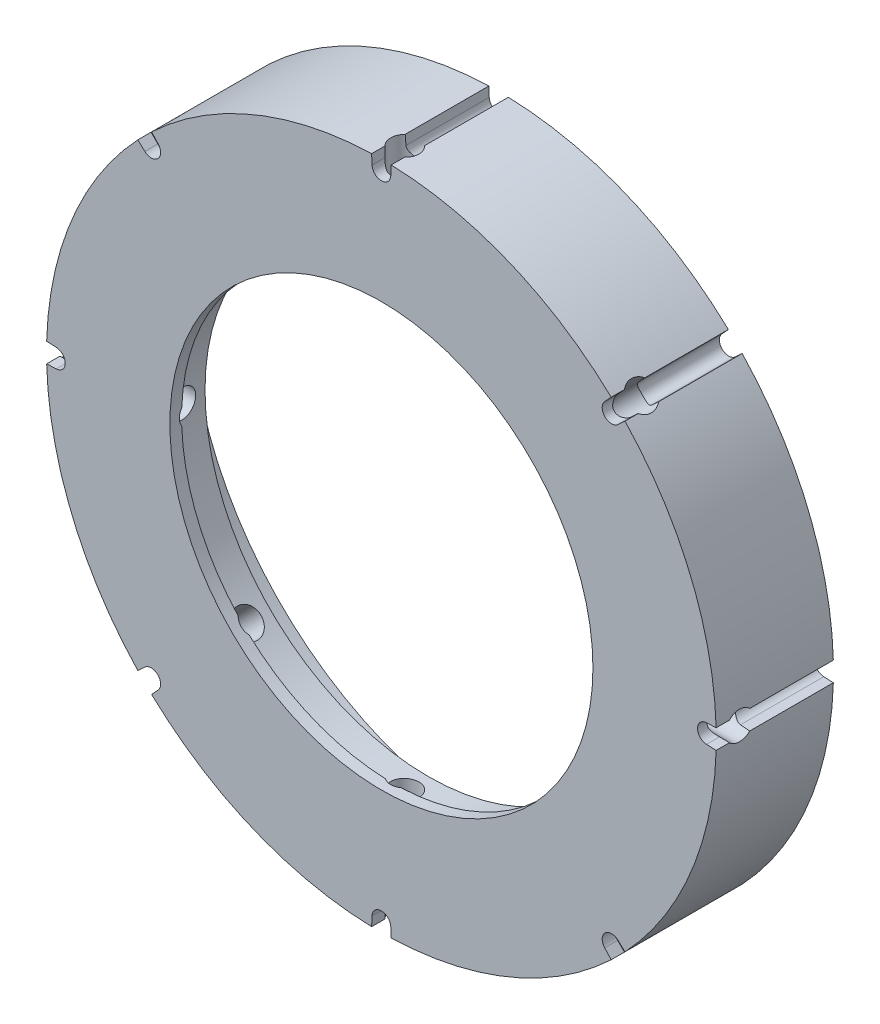
from build123d import *

# Parameters (mm, degrees)
SKETCH1_R           = 14.2875
SKETCH1_R_2         = 13.15
BOSS_EXTRUDE1_DEPTH = 3
BOSS_EXTRUDE2_START = 2
SKETCH2_R           = 14.2875
SKETCH2_R_2         = 9.025
BOSS_EXTRUDE2_DEPTH = 2
SKETCH4_R           = 9.525
CUT_EXTRUDE2_DEPTH  = 1.5
CUT_EXTRUDE4_DEPTH  = 21.815026123
SKETCH6_R           = 0.6
CUT_EXTRUDE5_DEPTH  = 10
CIRPATTERN1_COUNT   = 8


with BuildPart() as part:
    # Sketch1 → Boss-Extrude1 (new body)
    with BuildSketch(Plane.XY):
        Circle(SKETCH1_R)
        Circle(SKETCH1_R_2, mode=Mode.SUBTRACT)
    extrude(amount=-BOSS_EXTRUDE1_DEPTH)

    # Sketch2 → Boss-Extrude2 (add)
    with BuildSketch(Plane.XY.offset(BOSS_EXTRUDE2_START)):
        Circle(SKETCH2_R)
        Circle(SKETCH2_R_2, mode=Mode.SUBTRACT)
    extrude(amount=-BOSS_EXTRUDE2_DEPTH)

    # Sketch4 → Cut-Extrude2 (cut)
    with BuildSketch(Plane(origin=(0, 0, 0), x_dir=(-1, 0, 0), z_dir=(0, 0, -1))):
        Circle(SKETCH4_R)
    extrude(amount=-CUT_EXTRUDE2_DEPTH, mode=Mode.SUBTRACT)

    # Sketch5 → Cut-Extrude4 (cut, through all)
    with BuildSketch(Plane(origin=(0, 0, -3), x_dir=(-1, 0, 0), z_dir=(0, 0, -1))):
        with BuildLine():
            ThreePointArc((-14.281422414, 0.416689427), (-14.2875, 0), (-14.281422414, -0.416689427))
            Line((-14.281422414, -0.416689427), (-13.870916856, -0.399656101))
            ThreePointArc((-13.870916856, -0.399656101), (-13.4875, 0), (-13.870916856, 0.399656101))
            Line((-13.870916856, 0.399656101), (-14.281422414, 0.416689427))
        make_face()
    cut_extrude4 = extrude(amount=-CUT_EXTRUDE4_DEPTH, mode=Mode.SUBTRACT)

    # Sketch6 → Cut-Extrude5 (cut)
    with BuildSketch(Plane(origin=(14.281422414, 0, 0), x_dir=(0, 0, -1), z_dir=(1, 0, 0))):
        with Locations((-1, 0)):
            Circle(SKETCH6_R)
    cut_extrude5 = extrude(amount=-CUT_EXTRUDE5_DEPTH, mode=Mode.SUBTRACT)

    # CirPattern1: Cut-Extrude4, Cut-Extrude5 ×8 about axis
    cirpattern1_axis = Axis((0, 0, 0), (0, 0, -1))
    add([cut_extrude4.rotate(cirpattern1_axis, i * 360 / CIRPATTERN1_COUNT) for i in range(1, CIRPATTERN1_COUNT)], mode=Mode.SUBTRACT)
    add([cut_extrude5.rotate(cirpattern1_axis, i * 360 / CIRPATTERN1_COUNT) for i in range(1, CIRPATTERN1_COUNT)], mode=Mode.SUBTRACT)


solid = part.part
